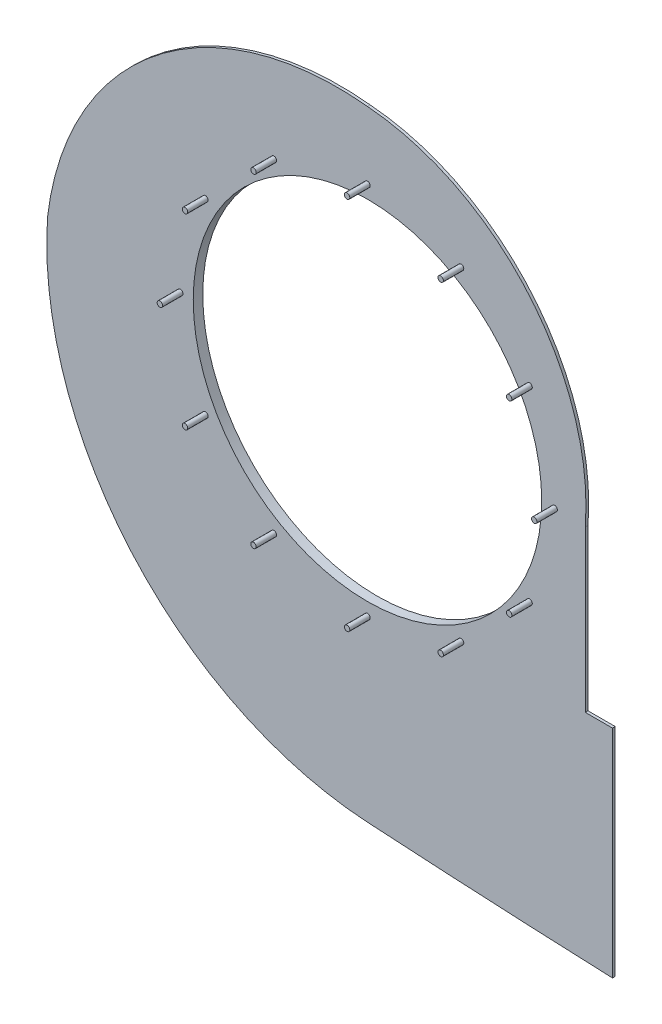
from build123d import *
from build123d.topology import SkipClean

# Parameters (mm, degrees)
BOSS_EXTRUDE1_DEPTH = 4
SKETCH2_R           = 256
CUT_EXTRUDE1_DEPTH  = 4
SKETCH3_R           = 258
SKETCH3_R_2         = 256
EXTRUDE_THIN1_DEPTH = 10
SKETCH5_R           = 4
BOSS_EXTRUDE2_DEPTH = 30
CIRPATTERN1_COUNT   = 12


with BuildPart() as part:
    # Sketch1 → Boss-Extrude1 (new body)
    with BuildSketch(Plane.XY):
        with BuildLine():
            Line((865.269127642, 521.057153497), (865.269127642, 757.057153497))
            ThreePointArc((865.269127642, 757.057153497), (782.812941082, 1010.7278743), (545.269127642, 1132.057153497))
            ThreePointArc((545.269127642, 1132.057153497), (233.519744905, 1040.749713195), (75.269127642, 757.057153497))
            ThreePointArc((75.269127642, 757.057153497), (198.687627947, 391.283260157), (545.269127642, 221.271697797))
            ThreePointArc((545.269127642, 221.271697797), (725.219790584, 211.189307063), (905.269127642, 203.057153497))
            Line((905.269127642, 203.057153497), (905.269127642, 521.057153497))
            Line((905.269127642, 521.057153497), (865.269127642, 521.057153497))
        make_face()
    extrude(amount=BOSS_EXTRUDE1_DEPTH)

    # Sketch2 → Cut-Extrude1 (cut)
    with BuildSketch(Plane.XY.offset(4)):
        with Locations((545.269127642, 758.057153497)):
            Circle(SKETCH2_R)
    extrude(amount=-CUT_EXTRUDE1_DEPTH, mode=Mode.SUBTRACT)

    # Sketch3 → Extrude-Thin1 (add)
    with SkipClean():  # the faces are left unmerged after this step: merging them gives an invalid solid
        with BuildSketch(Plane(origin=(0, 0, 0), x_dir=(-1, 0, 0), z_dir=(0, 0, -1))):
            with Locations((-545.269127642, 758.057153497)):
                Circle(SKETCH3_R)
            with Locations((-545.269127642, 758.057153497)):
                Circle(SKETCH3_R_2, mode=Mode.SUBTRACT)
        extrude(amount=EXTRUDE_THIN1_DEPTH)
    add(part.part.scale(1), mode=Mode.REPLACE)  # the faces are merged on a copy

    # Sketch5 → Boss-Extrude2 (add)
    with BuildSketch(Plane.XY.offset(4)):
        with Locations((545.269127642, 1033.057153497)):
            Circle(SKETCH5_R)
    boss_extrude2 = extrude(amount=BOSS_EXTRUDE2_DEPTH)

    # CirPattern1: Boss-Extrude2 ×12 about axis
    cirpattern1_axis = Axis((545.269127642, 758.057153497, 4), (0, 0, 1))
    for i in range(1, CIRPATTERN1_COUNT):
        add(boss_extrude2.rotate(cirpattern1_axis, i * 360 / CIRPATTERN1_COUNT))


solid = part.part
